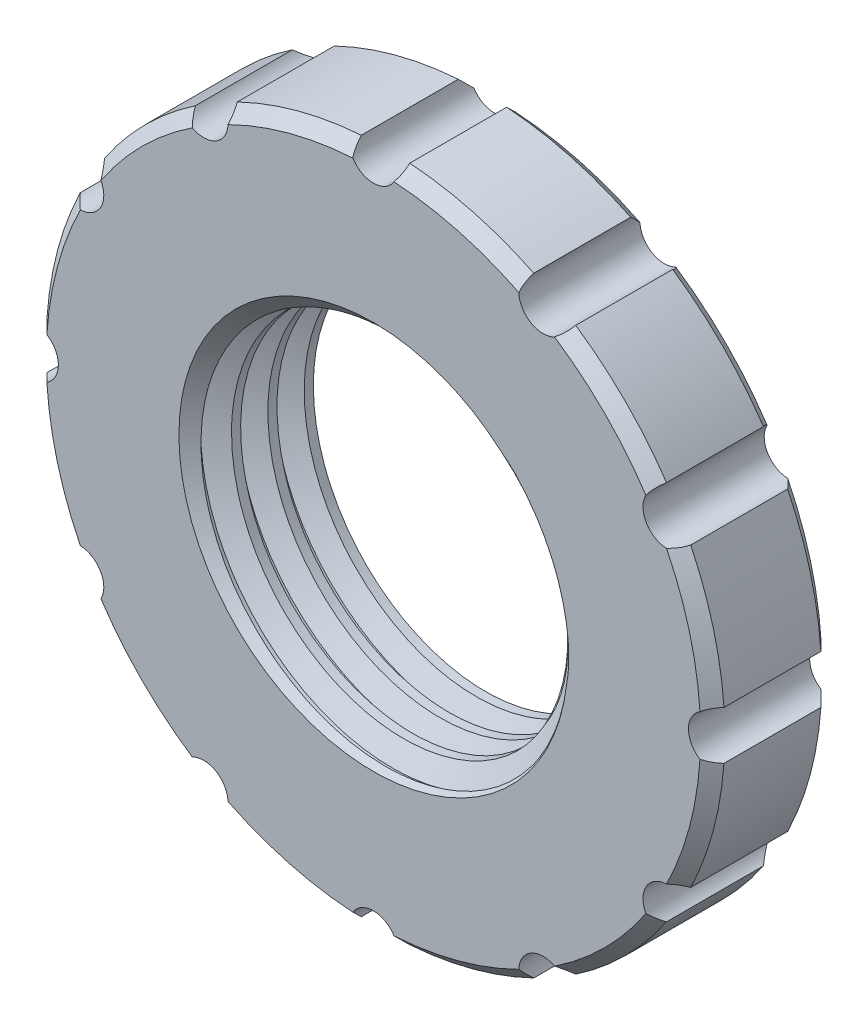
from build123d import *

# Parameters (mm, degrees)
SKETCH1_R           = 14
BOSS_EXTRUDE1_DEPTH = 5
CHAMFER1_SIZE       = 0.5
CHAMFER3_SIZE       = 0.5
SKETCH6_R           = 1
CUT_EXTRUDE2_DEPTH  = 21.420577857
SKETCH8_R           = 11.25
SKETCH8_R_2         = 9
CUT_EXTRUDE3_DEPTH  = 1
THREAD2_PITCH       = 1.5


with BuildPart() as part:
    # Sketch1 → Boss-Extrude1 (new body)
    with BuildSketch(Plane.XY):
        Circle(SKETCH1_R)
    extrude(amount=BOSS_EXTRUDE1_DEPTH)

    # Chamfer1
    chamfer1_edges = [part.edges().sort_by_distance(p)[0] for p in [
        (-14, 0, 0),
    ]]
    chamfer(chamfer1_edges, length=CHAMFER1_SIZE)

    # Chamfer3
    chamfer3_edges = [part.edges().sort_by_distance(p)[0] for p in [
        (-14, 0, 5),
    ]]
    chamfer(chamfer3_edges, length=CHAMFER3_SIZE)

    # Sketch6 → Cut-Extrude2 (cut, through all)
    with BuildSketch(Plane.XY.offset(5)):
        with Locations((0, 14)):
            Circle(SKETCH6_R)
        with Locations((7, 12.124355653)):
            Circle(SKETCH6_R)
        with Locations((12.124355653, 7)):
            Circle(SKETCH6_R)
        with Locations((14, 0)):
            Circle(SKETCH6_R)
        with Locations((12.124355653, -7)):
            Circle(SKETCH6_R)
        with Locations((7, -12.124355653)):
            Circle(SKETCH6_R)
        with Locations((0, -14)):
            Circle(SKETCH6_R)
        with Locations((-7, -12.124355653)):
            Circle(SKETCH6_R)
        with Locations((-12.124355653, -7)):
            Circle(SKETCH6_R)
        with Locations((-14, 0)):
            Circle(SKETCH6_R)
        with Locations((-12.124355653, 7)):
            Circle(SKETCH6_R)
        with Locations((-7, 12.124355653)):
            Circle(SKETCH6_R)
    extrude(amount=-CUT_EXTRUDE2_DEPTH, mode=Mode.SUBTRACT)

    # Sketch8 → Cut-Extrude3 (cut)
    with BuildSketch(Plane(origin=(0, 0, 0), x_dir=(-1, 0, 0), z_dir=(0, 0, -1))):
        Circle(SKETCH8_R)
        Circle(SKETCH8_R_2, mode=Mode.SUBTRACT)
    extrude(amount=-CUT_EXTRUDE3_DEPTH, mode=Mode.SUBTRACT)

    # Sketch10 → M16x1.5 Tapped Hole1 (revolve, cut)
    with BuildSketch(Plane(origin=(0, 0, 5), x_dir=(0, -1, 0), z_dir=(1, 0, 0))):
        Polygon((0, 0), (0, 5), (7.25, 5), (7.25, 0.775), (8.025, 0), align=None)
    revolve(axis=Axis((0, 0, 11.35), (0, 0, -1)), mode=Mode.SUBTRACT)

    # Thread2: the profile of Thread Profile2 profile screwed along a right-hand helix of 5.333333 turns, 8 arcs to a turn; built about Z, then put on its axis
    thread2_z = Axis((0, 0, 0), (0, 0, 1))
    thread2_corners = [(7.2497, 0, -0.000173205), (8.061898812, 0, 0.468749998), (8.061898812, 0, 0.656249998), (7.2497, 0, 1.125173201)]
    with BuildLine(mode=Mode.PRIVATE) as thread2_profile:
        Line(thread2_corners[0], thread2_corners[1])
        Line(thread2_corners[1], thread2_corners[2])
        Line(thread2_corners[2], thread2_corners[3])
        Line(thread2_corners[3], thread2_corners[0])
    thread2_cap = Face(thread2_profile.wire())
    thread2_turn_angles = [0, 22.5, 45, 67.5, 90, 112.5, 135, 157.5, 180, 202.5, 225, 247.5, 270, 292.5, 315, 337.5, 360]
    thread2_turn_weights = [1, 0.9238795325112867, 1, 0.9238795325112867, 1, 0.9238795325112867, 1, 0.9238795325112867, 1, 0.9238795325112867, 1, 0.9238795325112867, 1, 0.9238795325112867, 1, 0.9238795325112867, 1]
    thread2_turn_rails = [Edge.make_bspline([Vector(p[0], p[1], 0).rotate(thread2_z, thread2_turn_angles[k]) / thread2_turn_weights[k] + Vector(0, 0, p[2] + THREAD2_PITCH * thread2_turn_angles[k] / 360) for k in range(17)], [0, 0, 0, 1, 1, 2, 2, 3, 3, 4, 4, 5, 5, 6, 6, 7, 7, 8, 8, 8], 2, thread2_turn_weights) for p in thread2_corners]
    thread2_turn_sides = [Face.make_surface_from_curves(thread2_turn_rails[p[0]], thread2_turn_rails[p[1]]) for p in [(0, 1), (1, 2), (2, 3), (3, 0)]]
    thread2_last_angles = [1800, 1822.5, 1845, 1867.5, 1890, 1905, 1920]
    thread2_last_weights = [1, 0.9238795325112867, 1, 0.9238795325112867, 1, 0.9659258262890688, 1]
    thread2_last_rails = [Edge.make_bspline([Vector(p[0], p[1], 0).rotate(thread2_z, thread2_last_angles[k]) / thread2_last_weights[k] + Vector(0, 0, p[2] + THREAD2_PITCH * thread2_last_angles[k] / 360) for k in range(7)], [0, 0, 0, 1, 1, 2, 2, 3, 3, 3], 2, thread2_last_weights) for p in thread2_corners]
    thread2_last_sides = [Face.make_surface_from_curves(thread2_last_rails[p[0]], thread2_last_rails[p[1]]) for p in [(0, 1), (1, 2), (2, 3), (3, 0)]]
    thread2 = Plane(origin=(0, 0, 6.225), x_dir=(-1, 0, 0), z_dir=(0, 0, -1)) * Solid(Shell([*[p.moved(Location((0, 0, THREAD2_PITCH * i))) for i in range(5) for p in thread2_turn_sides], *thread2_last_sides, thread2_cap, thread2_cap.rotate(thread2_z, 1920).moved(Location((0, 0, THREAD2_PITCH * 1920 / 360)))]))
    add(thread2, mode=Mode.SUBTRACT)


solid = part.part
